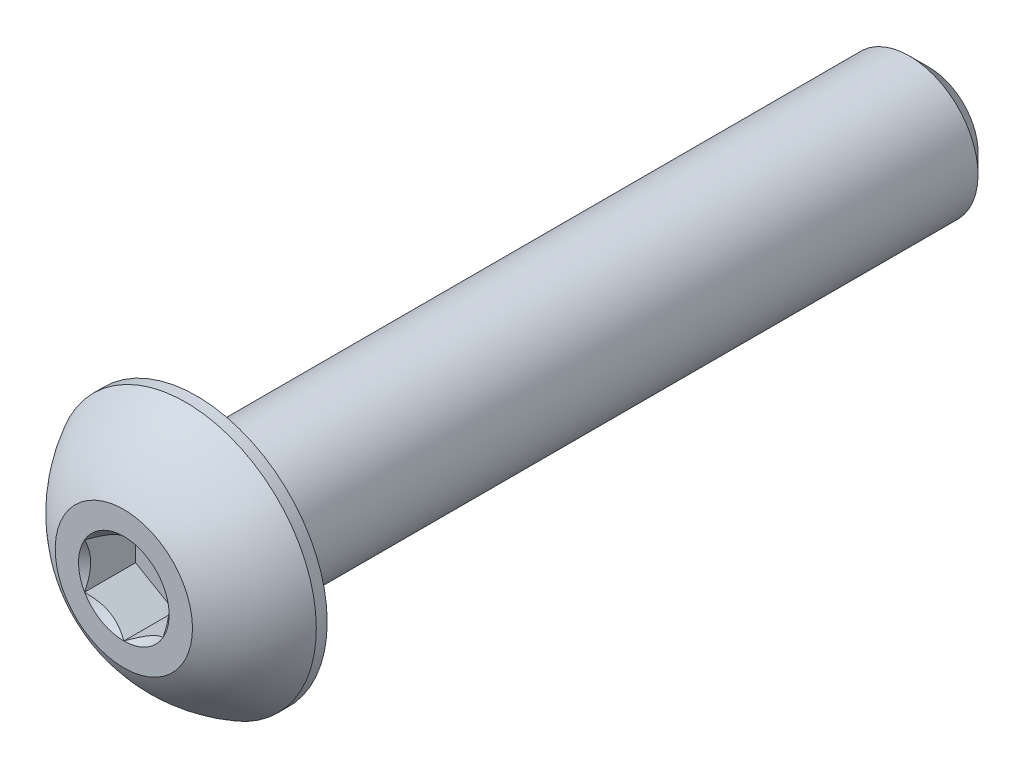
from build123d import *

# Parameters (mm, degrees)
SKETCH1_W          = 22.225
SKETCH1_H          = 2.0828
CHAMFER1_SIZE      = 0.5953125
CUT_EXTRUDE2_DEPTH = 1.54686


with BuildPart() as part:
    # Sketch1 → Revolve1 (revolve)
    with BuildSketch(Plane(origin=(0, 0, 0), x_dir=(0, 0, -1), z_dir=(1, 0, 0))):
        with Locations((13.3223, 1.0414)):
            Rectangle(SKETCH1_W, SKETCH1_H)
    revolve(axis=Axis((0, 0, -24.4348), (0, 0, 1)))

    # Chamfer1
    chamfer1_edges = [part.edges().sort_by_distance(p)[0] for p in [
        (0, -2.0828, -24.4348),
    ]]
    chamfer(chamfer1_edges, length=CHAMFER1_SIZE)

    # Sketch7 → Revolve2 (revolve)
    with BuildSketch(Plane(origin=(0, 0, 0), x_dir=(0, 0, -1), z_dir=(1, 0, 0))):
        with BuildLine():
            Line((1.87833, 3.9624), (2.2098, 3.9624))
            Line((2.2098, 3.9624), (2.2098, 0))
            Line((2.2098, 0), (0, 0))
            Line((0, 0), (0, 2.0828))
            ThreePointArc((0, 2.0828), (0.796523813, 3.165144808), (1.87833, 3.9624))
        make_face()
    revolve(axis=Axis((0, 0, 0), (0, 0, -1)))

    # Sketch5 → Cut-Extrude2 (cut)
    with BuildSketch(Plane.XY):
        Polygon((1.190625, -0.687407664), (1.190625, 0.687407664), (0, 1.374815329), (-1.190625, 0.687407664), (-1.190625, -0.687407664), (0, -1.374815329), align=None)
    extrude(amount=-CUT_EXTRUDE2_DEPTH, mode=Mode.SUBTRACT)

    # Cut-Extrude3 cone 1 section (through the dimple's axis) → Cut-Extrude3 (revolve, cut)
    with BuildSketch(Plane(origin=(0, 0, 0), x_dir=(0, -1, 0), z_dir=(1, 0, 0))):
        Polygon((0, 0), (1.374815329, 0), (0, 1.374815329), align=None)
    revolve(axis=Axis((0, 0, 0), (0, 0, -1)), mode=Mode.SUBTRACT)


solid = part.part
